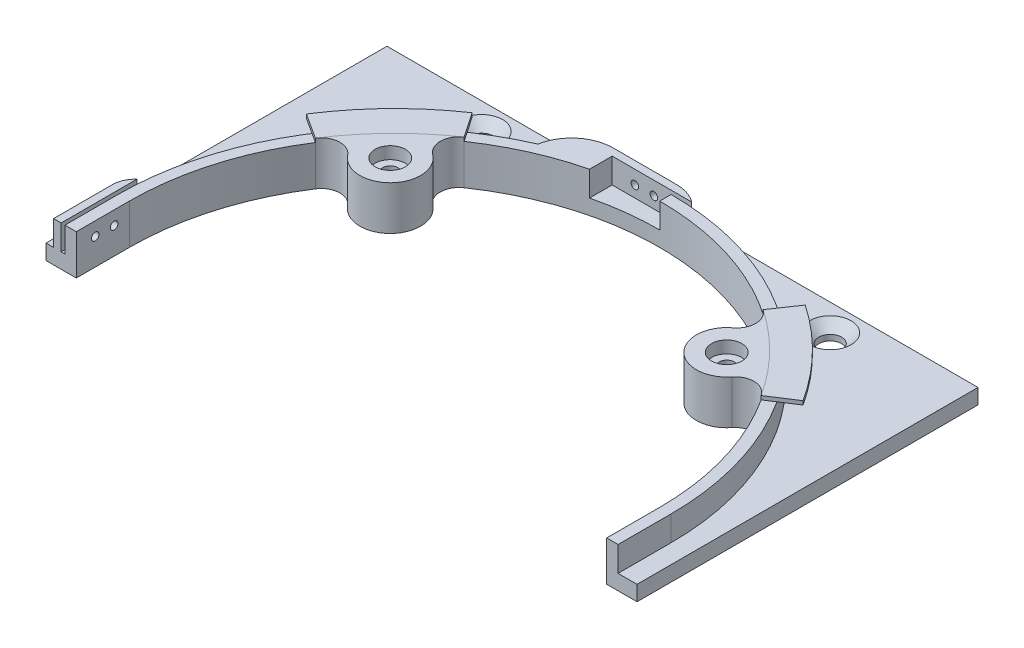
from build123d import *

# Parameters (mm, degrees)
BOSS_EXTRUDE1_DEPTH                          = 3.3
BOSS_EXTRUDE2_DEPTH                          = 2
BOSS_EXTRUDE3_DEPTH                          = 0.5
BOSS_EXTRUDE3_DEPTH_BACK                     = 5.3
BOSS_EXTRUDE4_DEPTH                          = 0.5
CBORE_FOR_M2_PAN_HEAD_SCREW2_AT_2_COUNT      = 2
CBORE_FOR_M2_PAN_HEAD_SCREW2_AT_2_PITCH      = 44.406234465
SKETCH13_W                                   = 1
SKETCH13_H                                   = 3.494688162
BOSS_EXTRUDE5_DEPTH                          = 10
FILLET1_R                                    = 3
SKETCH15_W                                   = 8.279859514
SKETCH15_H                                   = 8.940793452
CUT_EXTRUDE2_DEPTH                           = 3.3
SKETCH19_W                                   = 0.5
SKETCH19_H                                   = 5
F_1_0_1_DIAMETER_HOLE2_AT_2_COUNT            = 2
F_1_0_1_DIAMETER_HOLE2_AT_2_PITCH            = 2.5
BOSS_EXTRUDE6_DEPTH                          = 3.3
FILLET2_R                                    = 5.5
CSK_FOR_M3_COUNTERSUNK_FLAT_HEAD_SCR_2_COUNT = 2
CSK_FOR_M3_COUNTERSUNK_FLAT_HEAD_SCR_2_PITCH = 46
FILLET3_R                                    = 5
SKETCH24_W                                   = 0.5
SKETCH24_H                                   = 1
F_1_0_1_DIAMETER_HOLE3_AT_2_COUNT            = 2
F_1_0_1_DIAMETER_HOLE3_AT_2_PITCH            = 2.5


with BuildPart() as part:
    # Sketch1 → Boss-Extrude1 (new body)
    with BuildSketch(Plane(origin=(0, 0, 0), x_dir=(1, 0, 0), z_dir=(0, 1, 0))):
        with BuildLine():
            Line((36.5, 0), (36.5, -7))
            Line((36.5, -7), (35, -7))
            Line((35, -7), (35, 0))
            ThreePointArc((35, 0), (0, 35), (-35, 0))
            Line((-35, 0), (-35, -7))
            Line((-35, -7), (-36.5, -7))
            Line((-36.5, -7), (-36.5, 0))
            ThreePointArc((-36.5, 0), (0, 36.5), (36.5, 0))
        make_face()
    extrude(amount=BOSS_EXTRUDE1_DEPTH)



with BuildPart() as body_2:
    # Sketch2 → Boss-Extrude2 (new body)
    with BuildSketch(Plane.XZ):
        with BuildLine():
            Line((-35, 7), (-39, 7))
            Line((-39, 7), (-39, -38))
            Line((-39, -38), (39, -38))
            Line((39, -38), (39, 7))
            Line((39, 7), (35, 7))
            Line((35, 7), (35, 0))
            ThreePointArc((35, 0), (0, -35), (-35, 0))
            Line((-35, 0), (-35, 7))
        make_face()
    extrude(amount=BOSS_EXTRUDE2_DEPTH)


with BuildPart() as part_1:
    add(part.part)

    add(body_2.part)  # Boss-Extrude3 merges body 2
    # Sketch3 → Boss-Extrude3 (add, two sides: drawn at the far end of the back side and taken through both)
    with BuildSketch(Plane(origin=(0, 3.3, 0), x_dir=(1, 0, 0), z_dir=(0, 1, 0)).offset(-BOSS_EXTRUDE3_DEPTH_BACK)):
        with BuildLine():
            ThreePointArc((-29.413030363, 18.970335918), (-27.429134486, 20.11257099), (-25.347106396, 19.160886774))
            ThreePointArc((-25.347106396, 19.160886774), (-19.33819888, 18.842347627), (-19.812679795, 24.840956181))
            ThreePointArc((-19.812679795, 24.840956181), (-20.81811257, 26.897567167), (-19.727783811, 28.91045738))
            ThreePointArc((-19.727783811, 28.91045738), (-25.068035585, 24.425265442), (-29.413030363, 18.970335918))
        make_face()
        with BuildLine():
            ThreePointArc((29.413030363, 18.970335918), (25.068035585, 24.425265442), (19.727783811, 28.91045738))
            ThreePointArc((19.727783811, 28.91045738), (20.81811257, 26.897567167), (19.812679795, 24.840956181))
            ThreePointArc((19.812679795, 24.840956181), (19.33819888, 18.842347627), (25.347106396, 19.160886774))
            ThreePointArc((25.347106396, 19.160886774), (27.429134486, 20.11257099), (29.413030363, 18.970335918))
        make_face()
    extrude(amount=BOSS_EXTRUDE3_DEPTH + BOSS_EXTRUDE3_DEPTH_BACK)

    # Sketch11 → CBORE for M2 Pan Head Screw2 (revolve, cut)
    with BuildSketch(Plane(origin=(-22.203117232, 3.8, -21.633806534), x_dir=(0, 0, 1), z_dir=(1, 0, 0))):
        Polygon((0, 0), (0, 30.600860619), (1, 30), (1, 1.6), (2, 1.6), (2, 0), align=None)
    cbore_for_m2_pan_head_screw2 = revolve(axis=Axis((-22.203117232, 10.15, -21.633806534), (0, -1, 0)), mode=Mode.SUBTRACT)

    # CBORE for M2 Pan Head Screw2 at 2: CBORE for M2 Pan Head Screw2 ×2
    with Locations(*[(i * CBORE_FOR_M2_PAN_HEAD_SCREW2_AT_2_PITCH, 0, 0) for i in range(1, CBORE_FOR_M2_PAN_HEAD_SCREW2_AT_2_COUNT)]):
        add(cbore_for_m2_pan_head_screw2, mode=Mode.SUBTRACT)

    # Sketch13 → Boss-Extrude5 (add)
    with BuildSketch(Plane.XY.offset(7)):
        with Locations((-37.5, 1.552655919)):
            Rectangle(SKETCH13_W, SKETCH13_H)
    extrude(amount=-BOSS_EXTRUDE5_DEPTH)

    # Fillet1
    # the kernel refuses this fillet: 3 mm, written as the material it takes off along each edge
    with BuildSketch(Plane(origin=(-38, 0, -3), x_dir=(0, 0, 1), z_dir=(0, 1, 0))) as fillet1_piece_1:
        with BuildLine():
            CenterArc((2.236067977, 3), FILLET1_R, 221.810314896, 48.189685104)
            Line((0, 1), (0, 0))
            Line((0, 0), (2.236067977, 0))
        make_face()
    extrude(amount=8.890169944, mode=Mode.SUBTRACT)

    # Sketch15 → Cut-Extrude2 (cut)
    with BuildSketch(Plane(origin=(0, 3.3, 0), x_dir=(1, 0, 0), z_dir=(0, 1, 0))):
        with Locations((-4.139929757, 32.029603274)):
            Rectangle(SKETCH15_W, SKETCH15_H)
    extrude(amount=-CUT_EXTRUDE2_DEPTH, mode=Mode.SUBTRACT)

    # Sketch19 → Ø1.0 (1) Diameter Hole2 (revolve, cut)
    with BuildSketch(Plane(origin=(-35, 1.5, 4.5), x_dir=(0, 0, -1), z_dir=(0, 1, 0))):
        with Locations((0.25, 2.5)):
            Rectangle(SKETCH19_W, SKETCH19_H)
    f_1_0_1_diameter_hole2 = revolve(axis=Axis((-28.65, 1.5, 4.5), (-1, 0, 0)), mode=Mode.SUBTRACT)

    # Ø1.0 (1) Diameter Hole2 at 2: Ø1.0 (1) Diameter Hole2 ×2
    with Locations(*[(0, 0, -i * F_1_0_1_DIAMETER_HOLE2_AT_2_PITCH) for i in range(1, F_1_0_1_DIAMETER_HOLE2_AT_2_COUNT)]):
        add(f_1_0_1_diameter_hole2, mode=Mode.SUBTRACT)

    # Sketch21 → Boss-Extrude6 (add)
    with BuildSketch(Plane(origin=(0, 0, 0), x_dir=(1, 0, 0), z_dir=(0, 1, 0))):
        Polygon((-0.279859514, 37), (2.220140486, 37), (2.220140486, 38), (-14.553693159, 38), (-14.553693159, 32.511000179), (-8.279859514, 34.006527703), (-8.279859514, 37), align=None)
    extrude(amount=BOSS_EXTRUDE6_DEPTH)

    # Fillet2
    # the kernel refuses this fillet: 5.5 mm, written as the material it takes off along each edge
    with BuildSketch(Plane(origin=(-14.553693159, 0, -38), x_dir=(0, 0, 1), z_dir=(0, 1, 0))) as fillet2_piece_1:
        with BuildLine():
            CenterArc((5.5, 5.413254179), FILLET2_R, 180, 79.810496336)
            Line((0, 5.413254179), (0, 0))
            Line((0, 0), (4.527025596, 0))
        make_face()
    extrude(amount=16.833135448, mode=Mode.SUBTRACT)

    # Sketch22 → CSK for M3 Countersunk Flat Head Screw1 (revolve, cut)
    with BuildSketch(Plane(origin=(-23, 0, -34.5), x_dir=(0, 0, 1), z_dir=(1, 0, 0))):
        Polygon((0, 0), (0, 2.001), (1.5, 2.001), (1.5, 1.25), (2.75, 0), align=None)
    csk_for_m3_countersunk_flat_head_screw1 = revolve(axis=Axis((-23, 6.35, -34.5), (0, -1, 0)), mode=Mode.SUBTRACT)

    # CSK for M3 Countersunk Flat Head Scr 2: CSK for M3 Countersunk Flat Head Screw1 ×2
    with Locations(*[(i * CSK_FOR_M3_COUNTERSUNK_FLAT_HEAD_SCR_2_PITCH, 0, 0) for i in range(1, CSK_FOR_M3_COUNTERSUNK_FLAT_HEAD_SCR_2_COUNT)]):
        add(csk_for_m3_countersunk_flat_head_screw1, mode=Mode.SUBTRACT)

    # Fillet3
    # the kernel refuses this fillet: 5 mm, written as the material it takes off along each edge
    with BuildSketch(Plane(origin=(2.220140486, 0, -38), x_dir=(0, 0, 1), z_dir=(0, 1, 0))) as fillet3_piece_1:
        with BuildLine():
            CenterArc((5, -3), FILLET3_R, 143.130102354, 36.869897646)
            Line((0, -3), (0, 0))
            Line((0, 0), (1, 0))
        make_face()
    extrude(amount=10.8, mode=Mode.SUBTRACT)

    # Sketch24 → Ø1.0 (1) Diameter Hole3 (revolve, cut)
    with BuildSketch(Plane(origin=(-5.279859514, 1.5, -37), x_dir=(0, -1, 0), z_dir=(1, 0, 0))):
        with Locations((0.25, 0.5)):
            Rectangle(SKETCH24_W, SKETCH24_H)
    f_1_0_1_diameter_hole3 = revolve(axis=Axis((-5.279859514, 1.5, -30.65), (0, 0, -1)), mode=Mode.SUBTRACT)

    # Ø1.0 (1) Diameter Hole3 at 2: Ø1.0 (1) Diameter Hole3 ×2
    with Locations(*[(i * F_1_0_1_DIAMETER_HOLE3_AT_2_PITCH, 0, 0) for i in range(1, F_1_0_1_DIAMETER_HOLE3_AT_2_COUNT)]):
        add(f_1_0_1_diameter_hole3, mode=Mode.SUBTRACT)


with BuildPart() as body_2_2:
    # Sketch9 → Boss-Extrude4 (new body)
    with BuildSketch(Plane(origin=(0, 3.3, 0), x_dir=(1, 0, 0), z_dir=(0, 1, 0))):
        with BuildLine():
            Line((-32.774519548, 21.138374309), (-30.673588807, 19.783350315))
            ThreePointArc((-30.673588807, 19.783350315), (-26.142379967, 25.472062532), (-20.57326026, 30.149476982))
            Line((-20.57326026, 30.149476982), (-21.982387675, 32.214509652))
            ThreePointArc((-21.982387675, 32.214509652), (-27.932953938, 27.21672435), (-32.774519548, 21.138374309))
        make_face()
        with BuildLine():
            Line((-30.673588807, 19.783350315), (-29.413030363, 18.970335918))
            ThreePointArc((-29.413030363, 18.970335918), (-25.068035585, 24.425265442), (-19.727783811, 28.91045738))
            Line((-19.727783811, 28.91045738), (-20.57326026, 30.149476982))
            ThreePointArc((-20.57326026, 30.149476982), (-26.142379967, 25.472062532), (-30.673588807, 19.783350315))
        make_face()
        with BuildLine():
            ThreePointArc((30.673588807, 19.783350315), (26.142379967, 25.472062532), (20.57326026, 30.149476982))
            Line((20.57326026, 30.149476982), (19.727783811, 28.91045738))
            ThreePointArc((19.727783811, 28.91045738), (25.068035585, 24.425265442), (29.413030363, 18.970335918))
            Line((29.413030363, 18.970335918), (30.673588807, 19.783350315))
        make_face()
        with BuildLine():
            Line((21.982387675, 32.214509652), (20.57326026, 30.149476982))
            ThreePointArc((20.57326026, 30.149476982), (26.142379967, 25.472062532), (30.673588807, 19.783350315))
            Line((30.673588807, 19.783350315), (32.774519548, 21.138374309))
            ThreePointArc((32.774519548, 21.138374309), (27.932953938, 27.21672435), (21.982387675, 32.214509652))
        make_face()
    extrude(amount=BOSS_EXTRUDE4_DEPTH)


solid = Compound([part_1.part, body_2_2.part])
